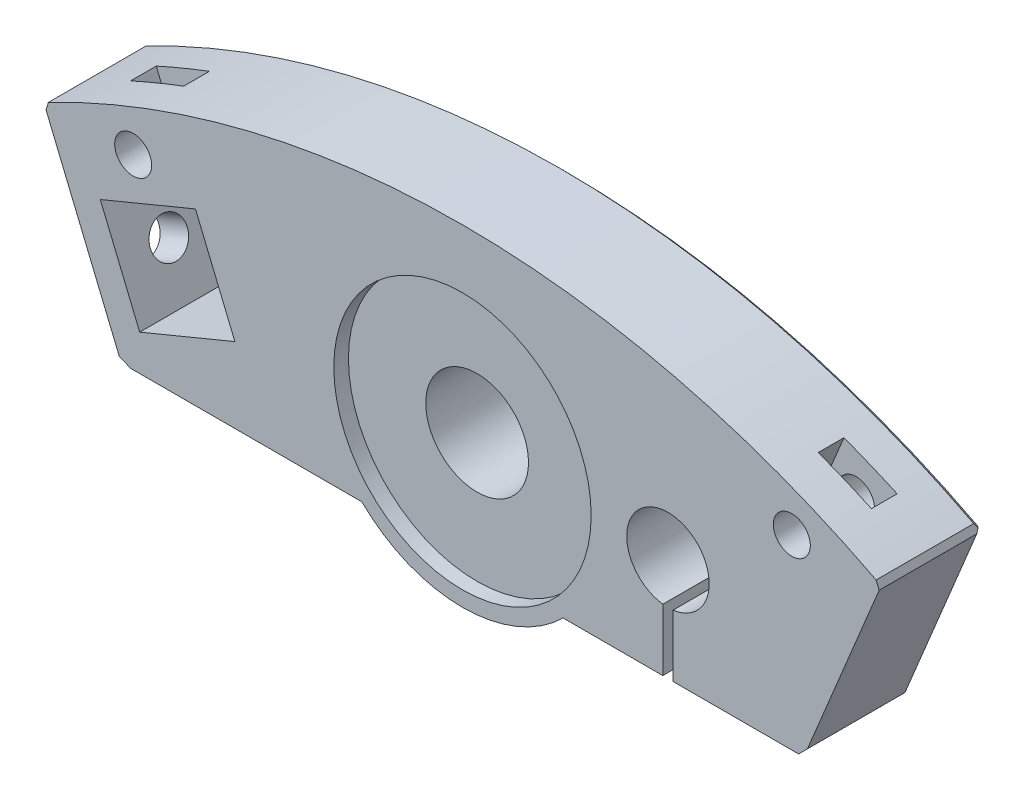
from build123d import *

# Parameters (mm, degrees)
SKETCH1_R           = 5
SKETCH1_R_2         = 1.8
BOSS_EXTRUDE1_DEPTH = 10
SKETCH2_R           = 12.525
CUT_EXTRUDE1_DEPTH  = 1.425
CHAMFER1_SIZE       = 0.5
CUT_EXTRUDE2_DEPTH  = 2.5
CHAMFER2_SIZE       = 0.5
SKETCH4_R           = 1.8
CUT_EXTRUDE3_DEPTH  = 10
CHAMFER3_SIZE       = 0.5
CHAMFER3_SIZE_2     = 0.923879533
CHAMFER3_SIZE_3     = 0.552958444


with BuildPart() as part:
    # Sketch1 → Boss-Extrude1 (new body)
    with BuildSketch(Plane.XY):
        with BuildLine():
            Line((-40.746699048, 8.183561953), (-33.214821075, -10))
            Line((-33.214821075, -10), (-9.797958971, -10))
            ThreePointArc((-9.797958971, -10), (0, -14), (9.797958971, -10))
            Line((9.797958971, -10), (19.5, -10))
            Line((19.5, -10), (19.5, -3.981225471))
            ThreePointArc((19.5, -3.981225471), (20, 4.0125), (20.5, -3.981225471))
            Line((20.5, -3.981225471), (20.5, -10))
            Line((20.5, -10), (33.214821075, -10))
            Line((33.214821075, -10), (40.746699048, 8.183561953))
            ThreePointArc((40.746699048, 8.183561953), (0, 18.25), (-40.746699048, 8.183561953))
        make_face()
        Circle(SKETCH1_R, mode=Mode.SUBTRACT)
        with Locations((-32.052211881, 8.130884627)):
            Circle(SKETCH1_R_2, mode=Mode.SUBTRACT)
        with Locations(Location((32.052211881, 8.130884627, 0), (0, 0, 180))):
            Circle(SKETCH1_R_2, mode=Mode.SUBTRACT)
        Polygon((-25.988511975, 6.5901118), (-35.250404289, 2.75371039), (-31.414002879, -6.508181923), (-22.152110566, -2.671780514), align=None, mode=Mode.SUBTRACT)
    extrude(amount=BOSS_EXTRUDE1_DEPTH)

    # Sketch2 → Cut-Extrude1 (cut)
    with BuildSketch(Plane.XY.offset(10)):
        Circle(SKETCH2_R)
    extrude(amount=-CUT_EXTRUDE1_DEPTH, mode=Mode.SUBTRACT)

    # Chamfer1
    chamfer1_edges = [part.edges().sort_by_distance(p)[0] for p in [
        (20, 4.0125, 0),
        (-24.070311271, 1.959165643, 0),
        (-30.619458132, 4.671911095, 0),
        (-33.332203584, -1.877235766, 0),
        (-26.783056723, -4.589981218, 0),
    ]]
    chamfer(chamfer1_edges, length=CHAMFER1_SIZE)

    # Sketch3 → Cut-Extrude2 (cut)
    with BuildSketch(Plane.XY.offset(3.75)):
        Polygon((-37.076762037, 12.944469155), (-33.567560961, 4.472508325), (-28.393835579, 6.615535546), (-31.903036655, 15.087496376), align=None)
        Polygon((37.076762037, 12.944469155), (33.567560961, 4.472508325), (28.393835579, 6.615535546), (31.903036655, 15.087496376), align=None)
    extrude(amount=CUT_EXTRUDE2_DEPTH, mode=Mode.SUBTRACT)

    # Chamfer2
    chamfer2_edges = [part.edges().sort_by_distance(p)[0] for p in [
        (14.648979486, -10, 0),
        (0, -14, 0),
        (-21.506390023, -10, 0),
        (-36.980760062, -0.908219024, 0),
        (0, 18.25, 0),
        (36.980760062, -0.908219024, 0),
        (26.857410538, -10, 0),
    ]]
    chamfer(chamfer2_edges, length=CHAMFER2_SIZE)

    # Sketch4 → Cut-Extrude3 (cut)
    with BuildSketch(Plane(origin=(-29.114518455, -12.059628406, 0), x_dir=(0, 0, -1), z_dir=(0.9238795325112882, 0.38268343236508634, 0))):
        with Locations(Location((-5.25, 11.021342374, 0), (0, 0, 90))):
            Circle(SKETCH4_R)
    extrude(amount=-CUT_EXTRUDE3_DEPTH, mode=Mode.SUBTRACT)

    # Chamfer3
    # the kernel refuses this chamfer: 0.923879533, 0.552958444, 0.5 mm, written as the material it takes off along each edge
    with BuildSketch(Plane(origin=(40.746699048, 8.183561953, -0.920037939), x_dir=(-0.38268343236508906, -0.923879532511287, 0), z_dir=(0, 0, 1))) as chamfer3_piece_1:
        with BuildLine():
            Line((CHAMFER3_SIZE, 0), (-0.048717445, -0.548717445))
            ThreePointArc((-0.048717445, -0.548717445), (-0.025540103, -0.282767493), (0, 0))
            Line((0, 0), (CHAMFER3_SIZE, 0))
        make_face()
    extrude(amount=12.340075878, mode=Mode.SUBTRACT)
    with BuildSketch(Plane(origin=(33.214821075, -10, -1.895315111), x_dir=(-1, 0, 0), z_dir=(0, 0, 1))) as chamfer3_piece_2:
        Polygon((CHAMFER3_SIZE, 0), (-CHAMFER3_SIZE_2 * 0.382683432163, -CHAMFER3_SIZE_2 * 0.923879532023), (0, 0), align=None)
    extrude(amount=14.290630221, mode=Mode.SUBTRACT)
    with BuildSketch(Plane(origin=(-33.214821075, -10, -1.895315111), x_dir=(1, 0, 0), z_dir=(0, 0, 1))) as chamfer3_piece_3:
        Polygon((CHAMFER3_SIZE_2, 0), (-CHAMFER3_SIZE * 0.382683432365, CHAMFER3_SIZE * 0.923879532511), (0, 0), align=None)
    extrude(amount=14.290630221, mode=Mode.SUBTRACT)
    with BuildSketch(Plane(origin=(-40.746699048, 8.183561953, -0.925350902), x_dir=(0.38268343236508684, -0.9238795325112881, 0), z_dir=(0, 0, 1))) as chamfer3_piece_4:
        with BuildLine():
            Line((CHAMFER3_SIZE_3, 0), (-0.04424113, 0.496614821))
            ThreePointArc((-0.04424113, 0.496614821), (-0.0231658, 0.256042208), (0, 0))
            Line((0, 0), (CHAMFER3_SIZE_3, 0))
        make_face()
    extrude(amount=12.350701805, mode=Mode.SUBTRACT)


solid = part.part
